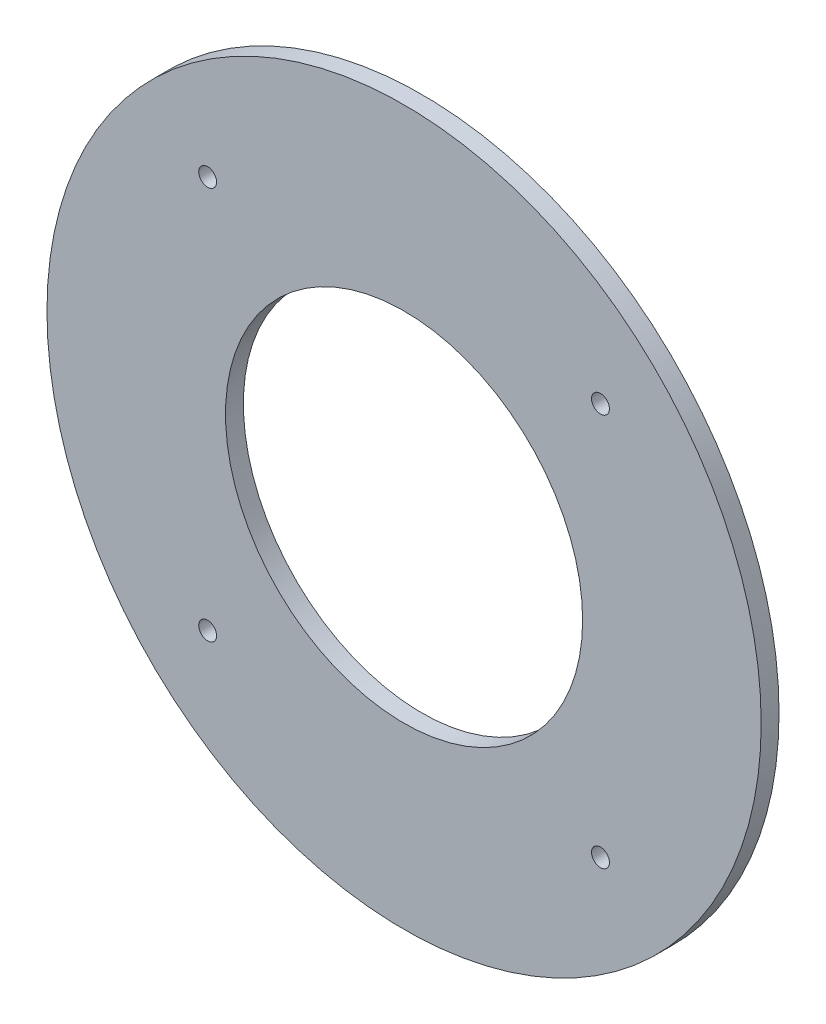
from build123d import *

# Parameters (mm, degrees)
SKETCH1_R           = 127
SKETCH1_R_2         = 63.5
SKETCH1_R_3         = 3.175
BOSS_EXTRUDE1_DEPTH = 6.35


with BuildPart() as part:
    # Sketch1 → Boss-Extrude1 (new body)
    with BuildSketch(Plane.XY):
        Circle(SKETCH1_R)
        Circle(SKETCH1_R_2, mode=Mode.SUBTRACT)
        with Locations((-69.85, 69.85)):
            Circle(SKETCH1_R_3, mode=Mode.SUBTRACT)
        with Locations((69.85, 69.85)):
            Circle(SKETCH1_R_3, mode=Mode.SUBTRACT)
        with Locations((-69.85, -69.85)):
            Circle(SKETCH1_R_3, mode=Mode.SUBTRACT)
        with Locations((69.85, -69.85)):
            Circle(SKETCH1_R_3, mode=Mode.SUBTRACT)
    extrude(amount=BOSS_EXTRUDE1_DEPTH)


solid = part.part
